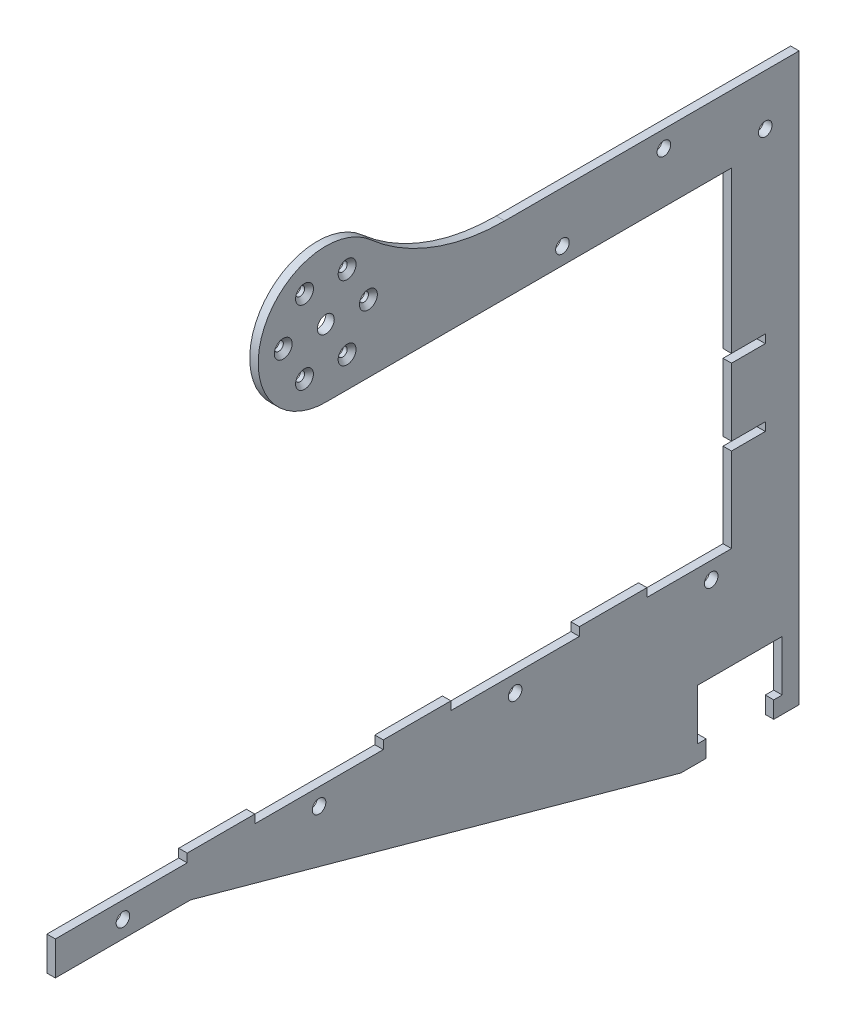
from build123d import *

# Parameters (mm, degrees)
BASE_FLANGE1_DEPTH           = 3.175
SKETCH8_W                    = 12.7
SKETCH8_H                    = 3.175
CUT_EXTRUDE2_DEPTH           = 309.926847379
SKETCH11_R                   = 3.175
CUT_EXTRUDE4_DEPTH           = 309.926847379
SKETCH21_R                   = 2.5527
CUT_EXTRUDE5_DEPTH           = 309.926847379
SKETCH23_W                   = 25.4
SKETCH23_H                   = 3.175
TAB1_DEPTH                   = 3.175
CSK_FOR_M3_SFHCS1_AT_2_COUNT = 2
CSK_FOR_M3_SFHCS1_AT_2_PITCH = 16
CSK_FOR_M3_SFHCS1_AT_3_COUNT = 2
CSK_FOR_M3_SFHCS1_AT_3_PITCH = 27.712812921
CSK_FOR_M3_SFHCS1_AT_4_COUNT = 2
CSK_FOR_M3_SFHCS1_AT_4_PITCH = 32
CSK_FOR_M3_SFHCS1_AT_5_COUNT = 2
CSK_FOR_M3_SFHCS1_AT_5_PITCH = 27.712812921
CSK_FOR_M3_SFHCS1_AT_6_COUNT = 2
CSK_FOR_M3_SFHCS1_AT_6_PITCH = 16


# Sheet-metal steps are written as plain solids
with BuildPart() as part:
    # Sketch1 → Base-Flange1 (new body)
    with BuildSketch(Plane(origin=(0, 0, 0), x_dir=(0, 0, -1), z_dir=(1, 0, 0))):
        with BuildLine():
            Line((0, -80.9625), (0, 80.9625))
            Line((0, 80.9625), (-110.597916699, 80.9625))
            ThreePointArc((-110.597916699, 80.9625), (-137.538685062, 85.883926782), (-160.999479175, 100.0125))
            ThreePointArc((-160.999479175, 100.0125), (-201.559524406, 89.942756121), (-177.8, 55.5625))
            Line((-177.8, 55.5625), (-25.4, 55.5625))
            Line((-25.4, 55.5625), (-25.4, -68.2625))
            Line((-25.4, -68.2625), (-279.4, -68.2625))
            Line((-279.4, -68.2625), (-279.4, -80.9625))
            Line((-279.4, -80.9625), (-228.6, -80.9625))
            Line((-228.6, -80.9625), (-44.45, -131.7625))
            Line((-44.45, -131.7625), (-34.925, -131.7625))
            Line((-34.925, -131.7625), (-34.925, -125.4125))
            Line((-34.925, -125.4125), (-38.1, -125.4125))
            Line((-38.1, -125.4125), (-38.1, -106.3625))
            Line((-38.1, -106.3625), (-6.35, -106.3625))
            Line((-6.35, -106.3625), (-6.35, -125.4125))
            Line((-6.35, -125.4125), (-9.525, -125.4125))
            Line((-9.525, -125.4125), (-9.525, -131.7625))
            Line((-9.525, -131.7625), (0, -131.7625))
            Line((0, -131.7625), (0, -80.9625))
        make_face()
    extrude(amount=-BASE_FLANGE1_DEPTH)

    # Sketch8 → Cut-Extrude2 (cut, through all)
    with BuildSketch(Plane(origin=(0, 0, 0), x_dir=(0, 0, -1), z_dir=(1, 0, 0))):
        with Locations((-19.05, -6.35)):
            Rectangle(SKETCH8_W, SKETCH8_H)
        with Locations((-19.05, -34.925)):
            Rectangle(SKETCH8_W, SKETCH8_H)
    extrude(amount=-CUT_EXTRUDE2_DEPTH, mode=Mode.SUBTRACT)

    # Sketch11 → Cut-Extrude4 (cut, through all)
    with BuildSketch(Plane(origin=(0, 0, 0), x_dir=(0, 0, -1), z_dir=(1, 0, 0))):
        with Locations((-177.8, 80.9625)):
            Circle(SKETCH11_R)
    extrude(amount=-CUT_EXTRUDE4_DEPTH, mode=Mode.SUBTRACT)

    # Sketch21 → Cut-Extrude5 (cut, through all)
    with BuildSketch(Plane(origin=(0, 0, 0), x_dir=(0, 0, -1), z_dir=(1, 0, 0))):
        with Locations((-33.02, -74.6125)):
            Circle(SKETCH21_R)
        with Locations((-106.68, -74.6125)):
            Circle(SKETCH21_R)
        with Locations((-180.34, -74.6125)):
            Circle(SKETCH21_R)
        with Locations((-254, -74.6125)):
            Circle(SKETCH21_R)
        with Locations((-12.7, 61.9125)):
            Circle(SKETCH21_R)
        with Locations((-50.8, 74.6125)):
            Circle(SKETCH21_R)
        with Locations((-88.9, 61.9125)):
            Circle(SKETCH21_R)
    extrude(amount=-CUT_EXTRUDE5_DEPTH, mode=Mode.SUBTRACT)

    # Sketch23 → Tab1 (add)
    with BuildSketch(Plane(origin=(0, 0, 0), x_dir=(0, 0, -1), z_dir=(1, 0, 0))):
        with Locations((-217.17, -66.675)):
            Rectangle(SKETCH23_W, SKETCH23_H)
        with Locations((-143.51, -66.675)):
            Rectangle(SKETCH23_W, SKETCH23_H)
        with Locations((-69.85, -66.675)):
            Rectangle(SKETCH23_W, SKETCH23_H)
    extrude(amount=-TAB1_DEPTH)

    # Sketch25 → CSK for M3 SFHCS1 (revolve, cut)
    with BuildSketch(Plane(origin=(0, 80.9625, 161.8), x_dir=(0, 0, -1), z_dir=(0, 1, 0))):
        Polygon((0, 0), (0, 3.175), (1.7, 3.175), (1.7, 1.66), (3.36, 0), align=None)
    csk_for_m3_sfhcs1 = revolve(axis=Axis((6.35, 80.9625, 161.8), (-1, 0, 0)), mode=Mode.SUBTRACT)

    # CSK for M3 SFHCS1 at 2: CSK for M3 SFHCS1 ×2
    with Locations(*[Vector(0, -0.8660254037844389, 0.4999999999999998) * (i * CSK_FOR_M3_SFHCS1_AT_2_PITCH) for i in range(1, CSK_FOR_M3_SFHCS1_AT_2_COUNT)]):
        add(csk_for_m3_sfhcs1, mode=Mode.SUBTRACT)

    # CSK for M3 SFHCS1 at 3: CSK for M3 SFHCS1 ×2
    with Locations(*[Vector(0, -0.500000000000002, 0.8660254037844376) * (i * CSK_FOR_M3_SFHCS1_AT_3_PITCH) for i in range(1, CSK_FOR_M3_SFHCS1_AT_3_COUNT)]):
        add(csk_for_m3_sfhcs1, mode=Mode.SUBTRACT)

    # CSK for M3 SFHCS1 at 4: CSK for M3 SFHCS1 ×2
    with Locations(*[(0, 0, i * CSK_FOR_M3_SFHCS1_AT_4_PITCH) for i in range(1, CSK_FOR_M3_SFHCS1_AT_4_COUNT)]):
        add(csk_for_m3_sfhcs1, mode=Mode.SUBTRACT)

    # CSK for M3 SFHCS1 at 5: CSK for M3 SFHCS1 ×2
    with Locations(*[Vector(0, 0.5000000000000007, 0.8660254037844384) * (i * CSK_FOR_M3_SFHCS1_AT_5_PITCH) for i in range(1, CSK_FOR_M3_SFHCS1_AT_5_COUNT)]):
        add(csk_for_m3_sfhcs1, mode=Mode.SUBTRACT)

    # CSK for M3 SFHCS1 at 6: CSK for M3 SFHCS1 ×2
    with Locations(*[Vector(0, 0.8660254037844379, 0.5000000000000013) * (i * CSK_FOR_M3_SFHCS1_AT_6_PITCH) for i in range(1, CSK_FOR_M3_SFHCS1_AT_6_COUNT)]):
        add(csk_for_m3_sfhcs1, mode=Mode.SUBTRACT)


solid = part.part
